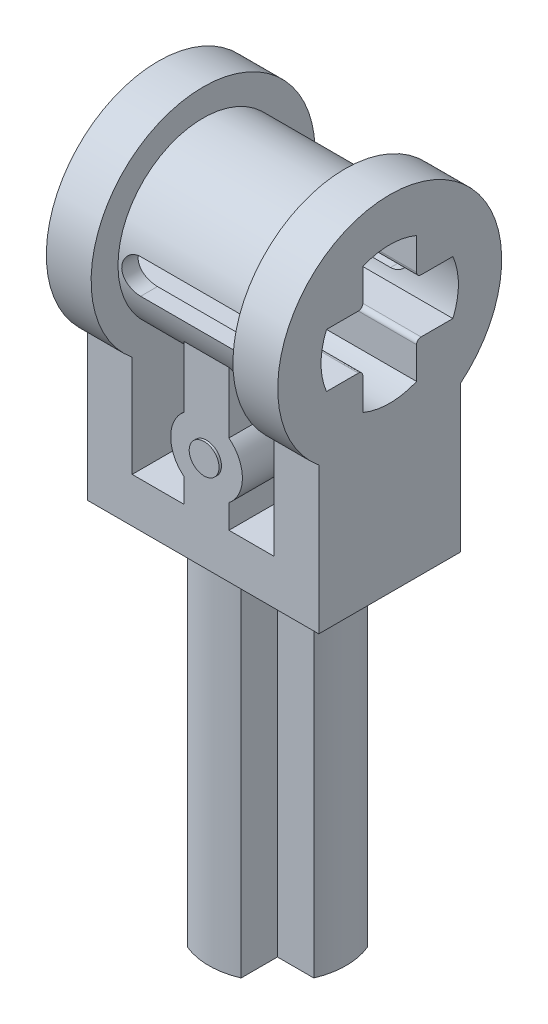
from build123d import *

# Parameters (mm, degrees)
SKETCH3_W               = 4.75
SKETCH3_H               = 5.746351638
BOSS_EXTRUDE1_DEPTH     = 0.4
BOSS_EXTRUDE2_DEPTH     = 2.375
BOSS_EXTRUDE3_DEPTH     = 2.375
CUT_EXTRUDE1_DEPTH      = 12.617443781
CUT_EXTRUDE2_DEPTH      = 10.530326191
CUT_EXTRUDE2_DEPTH_BACK = 10.530326191
WRAP1_OUTLINE_R         = 0.5
WRAP1_DEPTH             = 0.08
BOSS_EXTRUDE4_DEPTH     = 11.54


# Read off the part's stored shape, not the designer's step: Wrap1
with BuildPart() as part:
    # Sketch1 → Revolve1 (revolve)
    with BuildSketch(Plane.XY, mode=Mode.PRIVATE) as revolve1_sk:
        Polygon((-3.990566038, 0), (3.759433962, 0), (3.759433962, 3.75), (2.259433962, 3.75), (2.259433962, 2.85), (-2.490566038, 2.85), (-2.490566038, 3.75), (-3.990566038, 3.75), align=None)
    revolve(revolve1_sk.sketch.rotate(Axis((-3.990566038, 0, 0), (1, 0, 0)), 180), axis=Axis((-3.990566038, 0, 0), (1, 0, 0)))

    # Sketch3 → Boss-Extrude1 (add, symmetric)
    with BuildSketch(Plane.XY):
        with Locations((-0.115566038, -3.426824181)):
            Rectangle(SKETCH3_W, SKETCH3_H)
    extrude(amount=BOSS_EXTRUDE1_DEPTH, both=True)

    # Sketch3<7> → Boss-Extrude2 (add, symmetric)
    with BuildSketch(Plane.XY):
        Polygon((2.259433962, -0.553648362), (2.259433962, -6.3), (-2.490566038, -6.3), (-2.490566038, -0.553648362), (-3.990566038, -0.553648362), (-3.990566038, -7.8), (3.759433962, -7.8), (3.759433962, -0.553648362), align=None)
    extrude(amount=BOSS_EXTRUDE2_DEPTH, both=True)

    # Sketch5 → Boss-Extrude3 (add, symmetric)
    with BuildSketch(Plane(origin=(0, 0, 0), x_dir=(-1, 0, 0), z_dir=(0, 0, -1))):
        with BuildLine():
            Line((-0.75, -6.3), (0.75, -6.3))
            Line((0.75, -6.3), (0.75, -5.497644806))
            ThreePointArc((0.75, -5.497644806), (1.2, -4.560895106), (0.75, -3.624145406))
            Line((0.75, -3.624145406), (0.75, -2.821790212))
            Line((0.75, -2.821790212), (0.75, -1.153612006))
            Line((0.75, -1.153612006), (-0.75, -1.153612006))
            Line((-0.75, -1.153612006), (-0.75, -2.821790212))
            Line((-0.75, -2.821790212), (-0.75, -3.624145406))
            ThreePointArc((-0.75, -3.624145406), (-1.2, -4.560895106), (-0.75, -5.497644806))
            Line((-0.75, -5.497644806), (-0.75, -6.3))
        make_face()
    extrude(amount=BOSS_EXTRUDE3_DEPTH, both=True)

    # Sketch2 → Cut-Extrude1 (cut, through all)
    with BuildSketch(Plane.ZY.offset(3.990566038)):
        with BuildLine():
            Line((-0.9, 2.116601049), (-0.9, 1.05))
            ThreePointArc((-0.9, 1.05), (-0.943933983, 0.943933983), (-1.05, 0.9))
            Line((-1.05, 0.9), (-2.116601049, 0.9))
            ThreePointArc((-2.116601049, 0.9), (-2.3, 0), (-2.116601049, -0.9))
            Line((-2.116601049, -0.9), (-1.05, -0.9))
            ThreePointArc((-1.05, -0.9), (-0.943933983, -0.943933983), (-0.9, -1.05))
            Line((-0.9, -1.05), (-0.9, -2.116601049))
            ThreePointArc((-0.9, -2.116601049), (0, -2.3), (0.9, -2.116601049))
            Line((0.9, -2.116601049), (0.9, -1.05))
            ThreePointArc((0.9, -1.05), (0.943933983, -0.943933983), (1.05, -0.9))
            Line((1.05, -0.9), (2.116601049, -0.9))
            ThreePointArc((2.116601049, -0.9), (2.3, 0), (2.116601049, 0.9))
            Line((2.116601049, 0.9), (1.05, 0.9))
            ThreePointArc((1.05, 0.9), (0.943933983, 0.943933983), (0.9, 1.05))
            Line((0.9, 1.05), (0.9, 2.116601049))
            ThreePointArc((0.9, 2.116601049), (0, 2.3), (-0.9, 2.116601049))
        make_face()
    extrude(amount=-CUT_EXTRUDE1_DEPTH, mode=Mode.SUBTRACT)

    # Sketch4 → Cut-Extrude2 (cut, two sides: drawn at the far end of the back side and taken through both)
    with BuildSketch(Plane.XY.offset(-CUT_EXTRUDE2_DEPTH_BACK)):
        with BuildLine():
            Line((-1.790566038, 0.575), (1.559433962, 0.575))
            ThreePointArc((1.559433962, 0.575), (2.134433962, 0), (1.559433962, -0.575))
            Line((1.559433962, -0.575), (-1.790566038, -0.575))
            ThreePointArc((-1.790566038, -0.575), (-2.365566038, 0), (-1.790566038, 0.575))
        make_face()
    extrude(amount=CUT_EXTRUDE2_DEPTH + CUT_EXTRUDE2_DEPTH_BACK, mode=Mode.SUBTRACT)

    # Wrap1 outline → Wrap1 (add)
    with BuildSketch(Plane.XY.offset(2.375)):
        with Locations((0, -4.560895106)):
            Circle(WRAP1_OUTLINE_R)
    extrude(amount=WRAP1_DEPTH)

    # Sketch7 → Boss-Extrude4 (add)
    with BuildSketch(Plane.XZ.offset(7.8)):
        with BuildLine():
            Line((-0.9, 2.116601049), (-0.9, 0.9))
            Line((-0.9, 0.9), (-2.116601049, 0.9))
            ThreePointArc((-2.116601049, 0.9), (-2.3, 0), (-2.116601049, -0.9))
            Line((-2.116601049, -0.9), (-0.9, -0.9))
            Line((-0.9, -0.9), (-0.9, -2.116601049))
            ThreePointArc((-0.9, -2.116601049), (0, -2.3), (0.9, -2.116601049))
            Line((0.9, -2.116601049), (0.9, -0.9))
            Line((0.9, -0.9), (2.116601049, -0.9))
            ThreePointArc((2.116601049, -0.9), (2.3, 0), (2.116601049, 0.9))
            Line((2.116601049, 0.9), (0.9, 0.9))
            Line((0.9, 0.9), (0.9, 2.116601049))
            ThreePointArc((0.9, 2.116601049), (0, 2.3), (-0.9, 2.116601049))
        make_face()
    extrude(amount=BOSS_EXTRUDE4_DEPTH)


solid = part.part
